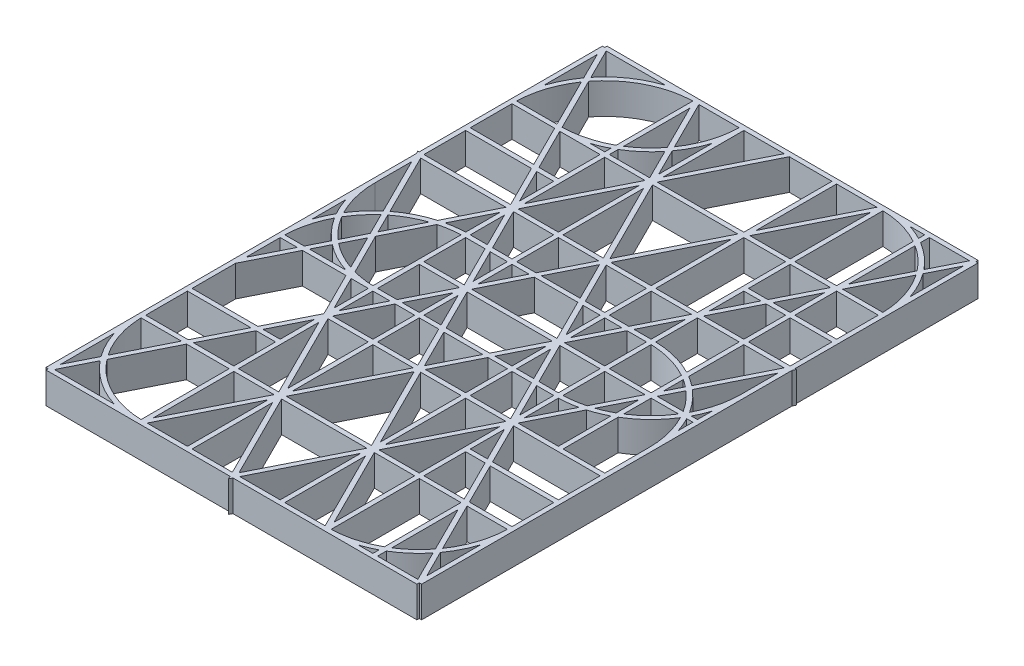
from build123d import *

# Parameters (mm, degrees)
EXTRUDE_THIN2_OUTLINE_W   = 27
EXTRUDE_THIN2_OUTLINE_H   = 57
EXTRUDE_THIN2_OUTLINE_H_2 = 27
EXTRUDE_THIN2_DEPTH       = 20
SKETCH2_W                 = 3
SKETCH2_H                 = 360
EXTRUDE_THIN3_DEPTH       = 20
EXTRUDE_THIN4_DEPTH       = 20


# Read off the part's stored shape, not the designer's step: Extrude-Thin2
with BuildPart() as part:
    # Extrude-Thin2 outline → Extrude-Thin2 (new body)
    with BuildSketch(Plane(origin=(0, 0, 0), x_dir=(1, 0, 0), z_dir=(0, 1, 0))):
        Polygon((121.5, 59.645898034), (122.427050983, 61.5), (121.5, 61.5), (121.5, 180), (120, 180), (120, 181.5), (-120, 181.5), (-120, 180), (-121.5, 180), (-121.5, 61.5), (-122.427050983, 61.5), (-121.5, 59.645898034), (-121.5, -180), (-120, -180), (-120, -181.5), (-0.927050983, -181.5), (0, -183.354101966), (0.927050983, -181.5), (120, -181.5), (120, -180), (121.5, -180), align=None)
        with BuildLine():
            Line((-78.973665961, -178.5), (-117.572949017, -178.5))
            Line((-117.572949017, -178.5), (-107.720276328, -158.794654622))
            ThreePointArc((-107.720276328, -158.794654622), (-94.772052623, -170.726268899), (-78.973665961, -178.5))
        make_face(mode=Mode.SUBTRACT)
        with BuildLine():
            Line((-109.752710213, -156.15131846), (-118.5, -173.645898034))
            Line((-118.5, -173.645898034), (-118.5, -138.973665961))
            ThreePointArc((-118.5, -138.973665961), (-114.803560591, -147.907342161), (-109.752710213, -156.15131846))
        make_face(mode=Mode.SUBTRACT)
        with BuildLine():
            Line((-106.240125251, -155.834352468), (-89.072949017, -121.5))
            Line((-89.072949017, -121.5), (-61.5, -121.5))
            Line((-61.5, -121.5), (-61.5, -178.480766069))
            ThreePointArc((-61.5, -178.480766069), (-86.419593146, -172.19439719), (-106.240125251, -155.834352468))
        make_face(mode=Mode.SUBTRACT)
        with BuildLine():
            Line((-92.427050983, -121.5), (-108.230509491, -153.106917015))
            ThreePointArc((-108.230509491, -153.106917015), (-115.646863197, -138.04651258), (-118.480766069, -121.5))
            Line((-118.480766069, -121.5), (-92.427050983, -121.5))
        make_face(mode=Mode.SUBTRACT)
        Polygon((-77.427050983, -91.5), (-90.927050983, -118.5), (-118.5, -118.5), (-118.5, -91.5), align=None, mode=Mode.SUBTRACT)
        Polygon((-61.5, -118.5), (-87.572949017, -118.5), (-74.072949017, -91.5), (-61.5, -91.5), align=None, mode=Mode.SUBTRACT)
        Polygon((-32.427050983, -121.5), (-58.5, -173.645898034), (-58.5, -121.5), align=None, mode=Mode.SUBTRACT)
        Polygon((-2.427050983, -178.5), (-57.572949017, -178.5), (-30, -123.354101966), align=None, mode=Mode.SUBTRACT)
        Polygon((-32.427050983, -118.5), (-58.5, -118.5), (-58.5, -66.354101966), align=None, mode=Mode.SUBTRACT)
        Polygon((-61.5, -66.354101966), (-61.5, -88.5), (-72.572949017, -88.5), align=None, mode=Mode.SUBTRACT)
        with BuildLine():
            Line((-118.5, -88.5), (-118.5, -60.354101966))
            Line((-118.5, -60.354101966), (-97.640758008, -18.635617983))
            ThreePointArc((-97.640758008, -18.635617983), (-87.885134957, -24.81486339), (-77.146332771, -29.061436424))
            Line((-77.146332771, -29.061436424), (-61.677050983, -60))
            Line((-61.677050983, -60), (-75.927050983, -88.5))
            Line((-75.927050983, -88.5), (-118.5, -88.5))
        make_face(mode=Mode.SUBTRACT)
        with BuildLine():
            Line((-118.5, -53.645898034), (-118.5, 11.026334039))
            ThreePointArc((-118.5, 11.026334039), (-111.174702214, -4.108647778), (-100.024034893, -16.693967821))
            Line((-100.024034893, -16.693967821), (-118.5, -53.645898034))
        make_face(mode=Mode.SUBTRACT)
        with BuildLine():
            Line((-61.5, -53.645898034), (-73.300701707, -30.044494619))
            ThreePointArc((-73.300701707, -30.044494619), (-67.435158767, -31.048901826), (-61.5, -31.481704596))
            Line((-61.5, -31.481704596), (-61.5, -53.645898034))
        make_face(mode=Mode.SUBTRACT)
        with BuildLine():
            Line((-90, -3.354101966), (-79.015417339, -25.323267288))
            ThreePointArc((-79.015417339, -25.323267288), (-88.04246695, -21.340725037), (-96.271829199, -15.897760365))
            Line((-96.271829199, -15.897760365), (-90, -3.354101966))
        make_face(mode=Mode.SUBTRACT)
        Polygon((-30, -116.645898034), (-57.572949017, -61.5), (-2.427050983, -61.5), align=None, mode=Mode.SUBTRACT)
        Polygon((-32.427050983, -1.5), (-58.5, -53.645898034), (-58.5, -1.5), align=None, mode=Mode.SUBTRACT)
        Polygon((-30, -3.354101966), (-2.427050983, -58.5), (-57.572949017, -58.5), align=None, mode=Mode.SUBTRACT)
        Polygon((0, -176.645898034), (-27.572949017, -121.5), (27.572949017, -121.5), align=None, mode=Mode.SUBTRACT)
        Polygon((28.5, -178.5), (2.427050983, -178.5), (28.5, -126.354101966), align=None, mode=Mode.SUBTRACT)
        Polygon((31.5, -126.354101966), (57.572949017, -178.5), (31.5, -178.5), align=None, mode=Mode.SUBTRACT)
        Polygon((58.5, -121.5), (58.5, -173.645898034), (32.427050983, -121.5), align=None, mode=Mode.SUBTRACT)
        Polygon((58.5, -66.354101966), (58.5, -118.5), (32.427050983, -118.5), align=None, mode=Mode.SUBTRACT)
        with BuildLine():
            ThreePointArc((78.973665961, -178.5), (83.82103752, -176.699278404), (88.5, -174.497706374))
            Line((88.5, -174.497706374), (88.5, -178.5))
            Line((88.5, -178.5), (78.973665961, -178.5))
        make_face(mode=Mode.SUBTRACT)
        with BuildLine():
            Line((61.5, -121.5), (88.5, -121.5))
            Line((88.5, -121.5), (88.5, -171.088159098))
            ThreePointArc((88.5, -171.088159098), (75.448710608, -176.423287219), (61.5, -178.480766069))
            Line((61.5, -178.480766069), (61.5, -121.5))
        make_face(mode=Mode.SUBTRACT)
        with BuildLine():
            ThreePointArc((91.5, -172.820450585), (100.226157951, -166.519955036), (107.720276328, -158.794654622))
            Line((107.720276328, -158.794654622), (117.572949017, -178.5))
            Line((117.572949017, -178.5), (91.5, -178.5))
            Line((91.5, -178.5), (91.5, -172.820450585))
        make_face(mode=Mode.SUBTRACT)
        with BuildLine():
            Line((91.5, -126.354101966), (106.240125251, -155.834352468))
            ThreePointArc((106.240125251, -155.834352468), (99.448437606, -163.19804128), (91.5, -169.295030175))
            Line((91.5, -169.295030175), (91.5, -126.354101966))
        make_face(mode=Mode.SUBTRACT)
        with BuildLine():
            ThreePointArc((109.752710213, -156.15131846), (114.803560591, -147.907342161), (118.5, -138.973665961))
            Line((118.5, -138.973665961), (118.5, -173.645898034))
            Line((118.5, -173.645898034), (109.752710213, -156.15131846))
        make_face(mode=Mode.SUBTRACT)
        Polygon((74.072949017, -91.5), (87.572949017, -118.5), (61.5, -118.5), (61.5, -91.5), align=None, mode=Mode.SUBTRACT)
        with BuildLine():
            ThreePointArc((118.480766069, -121.5), (115.646863197, -138.04651258), (108.230509491, -153.106917015))
            Line((108.230509491, -153.106917015), (92.427050983, -121.5))
            Line((92.427050983, -121.5), (118.480766069, -121.5))
        make_face(mode=Mode.SUBTRACT)
        Polygon((77.427050983, -91.5), (118.5, -91.5), (118.5, -118.5), (90.927050983, -118.5), align=None, mode=Mode.SUBTRACT)
        Polygon((27.572949017, -118.5), (-27.572949017, -118.5), (0, -63.354101966), align=None, mode=Mode.SUBTRACT)
        Polygon((2.427050983, -61.5), (28.5, -61.5), (28.5, -113.645898034), align=None, mode=Mode.SUBTRACT)
        Polygon((57.572949017, -61.5), (31.5, -113.645898034), (31.5, -61.5), align=None, mode=Mode.SUBTRACT)
        Polygon((27.572949017, -1.5), (0, -56.645898034), (-27.572949017, -1.5), align=None, mode=Mode.SUBTRACT)
        Polygon((28.5, -6.354101966), (28.5, -58.5), (2.427050983, -58.5), align=None, mode=Mode.SUBTRACT)
        Polygon((31.5, -6.354101966), (57.572949017, -58.5), (31.5, -58.5), align=None, mode=Mode.SUBTRACT)
        Polygon((58.5, -1.5), (58.5, -53.645898034), (32.427050983, -1.5), align=None, mode=Mode.SUBTRACT)
        Polygon((72.572949017, -88.5), (61.5, -88.5), (61.5, -66.354101966), align=None, mode=Mode.SUBTRACT)
        Polygon((62.427050983, -61.5), (118.5, -61.5), (118.5, -88.5), (75.927050983, -88.5), align=None, mode=Mode.SUBTRACT)
        Polygon((88.5, -6.354101966), (88.5, -58.5), (62.427050983, -58.5), align=None, mode=Mode.SUBTRACT)
        Polygon((87.572949017, -1.5), (61.5, -53.645898034), (61.5, -1.5), align=None, mode=Mode.SUBTRACT)
        with Locations((105, -30)):
            Rectangle(EXTRUDE_THIN2_OUTLINE_W, EXTRUDE_THIN2_OUTLINE_H, mode=Mode.SUBTRACT)
        with BuildLine():
            Line((-91.677050983, 0), (-98.638876906, -13.923651846))
            ThreePointArc((-98.638876906, -13.923651846), (-113.30395998, 5.897347646), (-118.5, 30))
            Line((-118.5, 30), (-118.5, 53.645898034))
            Line((-118.5, 53.645898034), (-91.677050983, 0))
        make_face(mode=Mode.SUBTRACT)
        with BuildLine():
            Line((-75.058626201, -26.528645632), (-88.322949017, 0))
            Line((-88.322949017, 0), (-61.5, 53.645898034))
            Line((-61.5, 53.645898034), (-61.5, -28.480766069))
            ThreePointArc((-61.5, -28.480766069), (-68.336649145, -27.902938449), (-75.058626201, -26.528645632))
        make_face(mode=Mode.SUBTRACT)
        Polygon((-62.427050983, 58.5), (-90, 3.354101966), (-117.572949017, 58.5), align=None, mode=Mode.SUBTRACT)
        Polygon((-75.927050983, 88.5), (-62.427050983, 61.5), (-118.5, 61.5), (-118.5, 88.5), align=None, mode=Mode.SUBTRACT)
        Polygon((-61.5, 88.5), (-61.5, 66.354101966), (-72.572949017, 88.5), align=None, mode=Mode.SUBTRACT)
        Polygon((-32.427050983, 1.5), (-58.5, 1.5), (-58.5, 53.645898034), align=None, mode=Mode.SUBTRACT)
        Polygon((-57.572949017, 58.5), (-2.427050983, 58.5), (-30, 3.354101966), align=None, mode=Mode.SUBTRACT)
        Polygon((-30, 116.645898034), (-2.427050983, 61.5), (-57.572949017, 61.5), align=None, mode=Mode.SUBTRACT)
        Polygon((-90.927050983, 118.5), (-77.427050983, 91.5), (-118.5, 91.5), (-118.5, 118.5), align=None, mode=Mode.SUBTRACT)
        Polygon((-61.5, 91.5), (-74.072949017, 91.5), (-87.572949017, 118.5), (-61.5, 118.5), align=None, mode=Mode.SUBTRACT)
        with BuildLine():
            Line((-118.5, 173.645898034), (-109.752710213, 156.15131846))
            ThreePointArc((-109.752710213, 156.15131846), (-114.803560591, 147.907342161), (-118.5, 138.973665961))
            Line((-118.5, 138.973665961), (-118.5, 173.645898034))
        make_face(mode=Mode.SUBTRACT)
        with BuildLine():
            Line((-108.230509491, 153.106917015), (-92.427050983, 121.5))
            Line((-92.427050983, 121.5), (-118.480766069, 121.5))
            ThreePointArc((-118.480766069, 121.5), (-115.646863197, 138.04651258), (-108.230509491, 153.106917015))
        make_face(mode=Mode.SUBTRACT)
        with BuildLine():
            ThreePointArc((-78.973665961, 178.5), (-94.772052623, 170.726268899), (-107.720276328, 158.794654622))
            Line((-107.720276328, 158.794654622), (-117.572949017, 178.5))
            Line((-117.572949017, 178.5), (-78.973665961, 178.5))
        make_face(mode=Mode.SUBTRACT)
        with BuildLine():
            Line((-61.5, 121.5), (-89.072949017, 121.5))
            Line((-89.072949017, 121.5), (-106.240125251, 155.834352468))
            ThreePointArc((-106.240125251, 155.834352468), (-86.419593146, 172.19439719), (-61.5, 178.480766069))
            Line((-61.5, 178.480766069), (-61.5, 121.5))
        make_face(mode=Mode.SUBTRACT)
        Polygon((-58.5, 118.5), (-32.427050983, 118.5), (-58.5, 66.354101966), align=None, mode=Mode.SUBTRACT)
        Polygon((-58.5, 173.645898034), (-32.427050983, 121.5), (-58.5, 121.5), align=None, mode=Mode.SUBTRACT)
        Polygon((-2.427050983, 178.5), (-30, 123.354101966), (-57.572949017, 178.5), align=None, mode=Mode.SUBTRACT)
        Polygon((0, 56.645898034), (27.572949017, 1.5), (-27.572949017, 1.5), align=None, mode=Mode.SUBTRACT)
        Polygon((2.427050983, 58.5), (28.5, 58.5), (28.5, 6.354101966), align=None, mode=Mode.SUBTRACT)
        Polygon((58.5, 53.645898034), (58.5, 1.5), (32.427050983, 1.5), align=None, mode=Mode.SUBTRACT)
        Polygon((31.5, 58.5), (57.572949017, 58.5), (31.5, 6.354101966), align=None, mode=Mode.SUBTRACT)
        Polygon((28.5, 113.645898034), (28.5, 61.5), (2.427050983, 61.5), align=None, mode=Mode.SUBTRACT)
        with Locations((45, 90)):
            Rectangle(EXTRUDE_THIN2_OUTLINE_W, EXTRUDE_THIN2_OUTLINE_H, mode=Mode.SUBTRACT)
        with Locations((75, 30)):
            Rectangle(EXTRUDE_THIN2_OUTLINE_W, EXTRUDE_THIN2_OUTLINE_H, mode=Mode.SUBTRACT)
        Polygon((118.5, 1.5), (92.427050983, 1.5), (118.5, 53.645898034), align=None, mode=Mode.SUBTRACT)
        Polygon((117.572949017, 58.5), (91.5, 6.354101966), (91.5, 58.5), align=None, mode=Mode.SUBTRACT)
        Polygon((61.5, 88.5), (72.572949017, 88.5), (61.5, 66.354101966), align=None, mode=Mode.SUBTRACT)
        Polygon((75.927050983, 88.5), (88.5, 88.5), (88.5, 61.5), (62.427050983, 61.5), align=None, mode=Mode.SUBTRACT)
        with Locations((105, 75)):
            Rectangle(EXTRUDE_THIN2_OUTLINE_W, EXTRUDE_THIN2_OUTLINE_H_2, mode=Mode.SUBTRACT)
        Polygon((-27.572949017, 118.5), (27.572949017, 118.5), (0, 63.354101966), align=None, mode=Mode.SUBTRACT)
        Polygon((28.5, 178.5), (28.5, 121.5), (-27.572949017, 121.5), (0.927050983, 178.5), align=None, mode=Mode.SUBTRACT)
        Polygon((58.5, 173.645898034), (58.5, 121.5), (32.427050983, 121.5), align=None, mode=Mode.SUBTRACT)
        Polygon((57.572949017, 178.5), (31.5, 126.354101966), (31.5, 178.5), align=None, mode=Mode.SUBTRACT)
        Polygon((87.572949017, 118.5), (74.072949017, 91.5), (61.5, 91.5), (61.5, 118.5), align=None, mode=Mode.SUBTRACT)
        Polygon((88.5, 113.645898034), (88.5, 91.5), (77.427050983, 91.5), align=None, mode=Mode.SUBTRACT)
        with Locations((105, 105)):
            Rectangle(EXTRUDE_THIN2_OUTLINE_W, EXTRUDE_THIN2_OUTLINE_H_2, mode=Mode.SUBTRACT)
        with BuildLine():
            Line((88.5, 171.088159098), (88.5, 121.5))
            Line((88.5, 121.5), (61.5, 121.5))
            Line((61.5, 121.5), (61.5, 178.480766069))
            ThreePointArc((61.5, 178.480766069), (75.448710608, 176.423287219), (88.5, 171.088159098))
        make_face(mode=Mode.SUBTRACT)
        with BuildLine():
            Line((88.5, 178.5), (88.5, 174.497706374))
            ThreePointArc((88.5, 174.497706374), (83.82103752, 176.699278404), (78.973665961, 178.5))
            Line((78.973665961, 178.5), (88.5, 178.5))
        make_face(mode=Mode.SUBTRACT)
        with BuildLine():
            Line((118.480766069, 121.5), (92.427050983, 121.5))
            Line((92.427050983, 121.5), (108.230509491, 153.106917015))
            ThreePointArc((108.230509491, 153.106917015), (115.646863197, 138.04651258), (118.480766069, 121.5))
        make_face(mode=Mode.SUBTRACT)
        with BuildLine():
            Line((106.240125251, 155.834352468), (91.5, 126.354101966))
            Line((91.5, 126.354101966), (91.5, 169.295030175))
            ThreePointArc((91.5, 169.295030175), (99.448437606, 163.19804128), (106.240125251, 155.834352468))
        make_face(mode=Mode.SUBTRACT)
        with BuildLine():
            ThreePointArc((118.5, 138.973665961), (114.803560591, 147.907342161), (109.752710213, 156.15131846))
            Line((109.752710213, 156.15131846), (118.5, 173.645898034))
            Line((118.5, 173.645898034), (118.5, 138.973665961))
        make_face(mode=Mode.SUBTRACT)
        with BuildLine():
            ThreePointArc((107.720276328, 158.794654622), (100.226157951, 166.519955036), (91.5, 172.820450585))
            Line((91.5, 172.820450585), (91.5, 178.5))
            Line((91.5, 178.5), (117.572949017, 178.5))
            Line((117.572949017, 178.5), (107.720276328, 158.794654622))
        make_face(mode=Mode.SUBTRACT)
    extrude(amount=EXTRUDE_THIN2_DEPTH)

    # Sketch2 → Extrude-Thin3 (add)
    with BuildSketch(Plane(origin=(0, 0, 0), x_dir=(1, 0, 0), z_dir=(0, 1, 0))):
        with Locations((-30, 0)):
            Rectangle(SKETCH2_W, SKETCH2_H)
        with BuildLine():
            Line((60, 31.5), (-60, 31.5))
            ThreePointArc((-60, 31.5), (-104.014202253, 12.95346319), (-121.481704596, -31.5))
            Line((-121.481704596, -31.5), (60, -31.5))
            ThreePointArc((60, -31.5), (103.487067043, -13.487067043), (121.5, 30))
            Line((121.5, 30), (118.5, 30))
            ThreePointArc((118.5, 30), (101.365746699, -11.365746699), (60, -28.5))
            Line((60, -28.5), (-118.480766069, -28.5))
            ThreePointArc((-118.480766069, -28.5), (-100.831972766, 11.892720131), (-60, 28.5))
            Line((-60, 28.5), (60, 28.5))
            Line((60, 28.5), (60, 31.5))
        make_face()
    extrude(amount=EXTRUDE_THIN3_DEPTH)

    # Sketch3 → Extrude-Thin4 (add)
    with BuildSketch(Plane(origin=(0, 0, 0), x_dir=(1, 0, 0), z_dir=(0, 1, 0))):
        with BuildLine():
            ThreePointArc((-90, 118.5), (-46.512932957, 136.512932957), (-28.5, 180))
            Line((-28.5, 180), (-31.5, 180))
            ThreePointArc((-31.5, 180), (-48.634253301, 138.634253301), (-90, 121.5))
            Line((-90, 121.5), (-90, 118.5))
        make_face()
        with BuildLine():
            ThreePointArc((121.5, -30), (103.487067043, 13.487067043), (60, 31.5))
            Line((60, 31.5), (60, 28.5))
            ThreePointArc((60, 28.5), (101.365746699, 11.365746699), (118.5, -30))
            Line((118.5, -30), (121.5, -30))
        make_face()
    extrude(amount=EXTRUDE_THIN4_DEPTH)


solid = part.part
